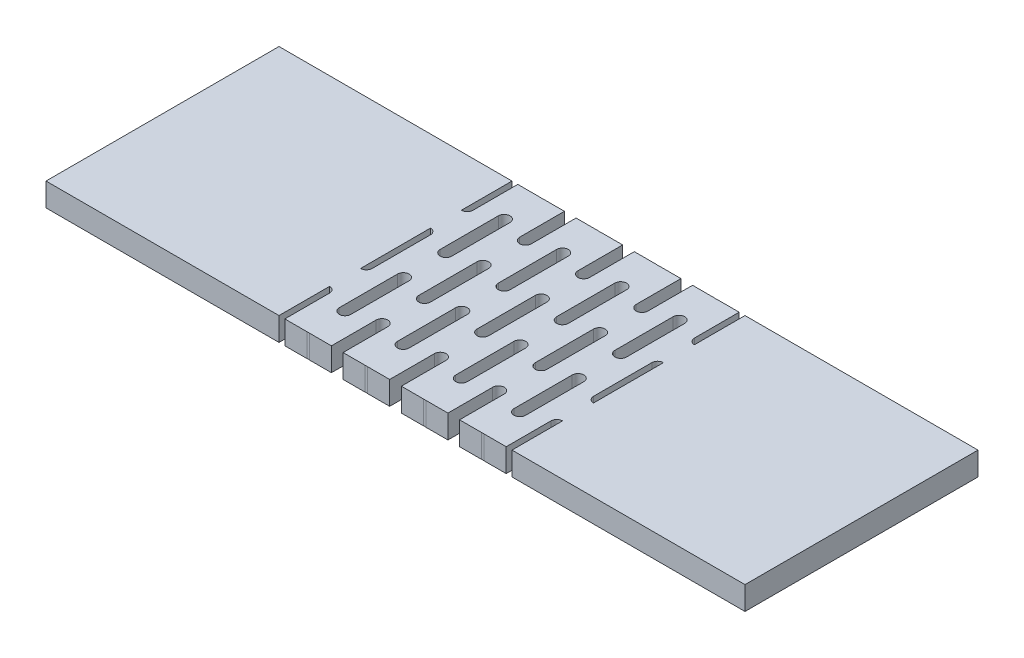
from build123d import *

# Parameters (mm, degrees)
SKETCH1_W           = 20
SKETCH1_H           = 20
BOSS_EXTRUDE1_DEPTH = 1
CUT_EXTRUDE1_DEPTH  = 1
FILL_START          = -1
FILL_PATTERN1_DEPTH = 2
SKETCH2_W           = 20
SKETCH2_H           = 20
BOSS_EXTRUDE2_DEPTH = 1


# Read off the part's stored shape, not the designer's step: Fill Pattern1
with BuildPart() as part:
    # Sketch1 → Boss-Extrude1 (new, symmetric)
    with BuildSketch(Plane(origin=(0, 0, 0), x_dir=(1, 0, 0), z_dir=(0, 1, 0))):
        Rectangle(SKETCH1_W, SKETCH1_H)
    extrude(amount=BOSS_EXTRUDE1_DEPTH, both=True)

    # Sketch1<4> → Cut-Extrude1 (cut, symmetric)
    with BuildSketch(Plane(origin=(0, 0, 0), x_dir=(1, 0, 0), z_dir=(0, 1, 0))):
        with BuildLine():
            Line((0.5, 2.5), (0.5, -2.5))
            ThreePointArc((0.5, -2.5), (0, -3), (-0.5, -2.5))
            Line((-0.5, -2.5), (-0.5, 2.5))
            ThreePointArc((-0.5, 2.5), (0, 3), (0.5, 2.5))
        make_face()
    extrude(amount=CUT_EXTRUDE1_DEPTH, both=True, mode=Mode.SUBTRACT)

    # Fill Pattern1 outline → Fill Pattern1 (cut)
    with BuildSketch(Plane(origin=(0, 0, 0), x_dir=(1, 0, 0), z_dir=(0, 1, 0)).offset(FILL_START)):
        with BuildLine():
            Line((0.5, -10), (0.5, -6.160254038))
            ThreePointArc((0.5, -6.160254038), (0, -5.660254038), (-0.5, -6.160254038))
            Line((-0.5, -6.160254038), (-0.5, -10))
            Line((-0.5, -10), (0.5, -10))
        make_face()
        with BuildLine():
            ThreePointArc((2.597603377, -10), (2.5, -9.990381057), (2.402396623, -10))
            Line((2.402396623, -10), (2.597603377, -10))
        make_face()
        with BuildLine():
            Line((-2.597603377, -10), (-2.402396623, -10))
            ThreePointArc((-2.402396623, -10), (-2.5, -9.990381057), (-2.597603377, -10))
        make_face()
        with BuildLine():
            Line((4.5, -6.160254038), (4.5, -10))
            Line((4.5, -10), (5.5, -10))
            Line((5.5, -10), (5.5, -6.160254038))
            ThreePointArc((5.5, -6.160254038), (5, -5.660254038), (4.5, -6.160254038))
        make_face()
        with BuildLine():
            Line((-5.5, -10), (-4.5, -10))
            Line((-4.5, -10), (-4.5, -6.160254038))
            ThreePointArc((-4.5, -6.160254038), (-5, -5.660254038), (-5.5, -6.160254038))
            Line((-5.5, -6.160254038), (-5.5, -10))
        make_face()
        with BuildLine():
            ThreePointArc((7.597603377, -10), (7.5, -9.990381057), (7.402396623, -10))
            Line((7.402396623, -10), (7.597603377, -10))
        make_face()
        with BuildLine():
            Line((-7.597603377, -10), (-7.402396623, -10))
            ThreePointArc((-7.402396623, -10), (-7.5, -9.990381057), (-7.597603377, -10))
        make_face()
        with BuildLine():
            Line((9.5, -6.160254038), (9.5, -10))
            Line((9.5, -10), (10, -10))
            Line((10, -10), (10, -5.660254038))
            ThreePointArc((10, -5.660254038), (9.646446609, -5.806700647), (9.5, -6.160254038))
        make_face()
        with BuildLine():
            Line((-10, -10), (-9.5, -10))
            Line((-9.5, -10), (-9.5, -6.160254038))
            ThreePointArc((-9.5, -6.160254038), (-9.646446609, -5.806700647), (-10, -5.660254038))
            Line((-10, -5.660254038), (-10, -10))
        make_face()
        with BuildLine():
            ThreePointArc((9.5, -2.5), (9.646446609, -2.853553391), (10, -3))
            Line((10, -3), (10, 3))
            ThreePointArc((10, 3), (9.646446609, 2.853553391), (9.5, 2.5))
            Line((9.5, 2.5), (9.5, -2.5))
        make_face()
        with BuildLine():
            Line((-10, 3), (-10, -3))
            ThreePointArc((-10, -3), (-9.646446609, -2.853553391), (-9.5, -2.5))
            Line((-9.5, -2.5), (-9.5, 2.5))
            ThreePointArc((-9.5, 2.5), (-9.646446609, 2.853553391), (-10, 3))
        make_face()
        with BuildLine():
            ThreePointArc((9.5, 6.160254038), (9.646446609, 5.806700647), (10, 5.660254038))
            Line((10, 5.660254038), (10, 10))
            Line((10, 10), (9.5, 10))
            Line((9.5, 10), (9.5, 6.160254038))
        make_face()
        with BuildLine():
            Line((-10, 10), (-10, 5.660254038))
            ThreePointArc((-10, 5.660254038), (-9.646446609, 5.806700647), (-9.5, 6.160254038))
            Line((-9.5, 6.160254038), (-9.5, 10))
            Line((-9.5, 10), (-10, 10))
        make_face()
        with BuildLine():
            ThreePointArc((7.402396623, 10), (7.5, 9.990381057), (7.597603377, 10))
            Line((7.597603377, 10), (7.402396623, 10))
        make_face()
        with BuildLine():
            Line((-7.402396623, 10), (-7.597603377, 10))
            ThreePointArc((-7.597603377, 10), (-7.5, 9.990381057), (-7.402396623, 10))
        make_face()
        with BuildLine():
            Line((5.5, 6.160254038), (5.5, 10))
            Line((5.5, 10), (4.5, 10))
            Line((4.5, 10), (4.5, 6.160254038))
            ThreePointArc((4.5, 6.160254038), (5, 5.660254038), (5.5, 6.160254038))
        make_face()
        with BuildLine():
            Line((-4.5, 10), (-5.5, 10))
            Line((-5.5, 10), (-5.5, 6.160254038))
            ThreePointArc((-5.5, 6.160254038), (-5, 5.660254038), (-4.5, 6.160254038))
            Line((-4.5, 6.160254038), (-4.5, 10))
        make_face()
        with BuildLine():
            ThreePointArc((2.402396623, 10), (2.5, 9.990381057), (2.597603377, 10))
            Line((2.597603377, 10), (2.402396623, 10))
        make_face()
        with BuildLine():
            Line((-2.402396623, 10), (-2.597603377, 10))
            ThreePointArc((-2.597603377, 10), (-2.5, 9.990381057), (-2.402396623, 10))
        make_face()
        with BuildLine():
            Line((0.5, 6.160254038), (0.5, 10))
            Line((0.5, 10), (-0.5, 10))
            Line((-0.5, 10), (-0.5, 6.160254038))
            ThreePointArc((-0.5, 6.160254038), (0, 5.660254038), (0.5, 6.160254038))
        make_face()
        with BuildLine():
            Line((8, -6.830127019), (8, -1.830127019))
            ThreePointArc((8, -1.830127019), (7.5, -1.330127019), (7, -1.830127019))
            Line((7, -1.830127019), (7, -6.830127019))
            ThreePointArc((7, -6.830127019), (7.5, -7.330127019), (8, -6.830127019))
        make_face()
        with BuildLine():
            Line((8, 1.830127019), (8, 6.830127019))
            ThreePointArc((8, 6.830127019), (7.5, 7.330127019), (7, 6.830127019))
            Line((7, 6.830127019), (7, 1.830127019))
            ThreePointArc((7, 1.830127019), (7.5, 1.330127019), (8, 1.830127019))
        make_face()
        with BuildLine():
            Line((5.5, -2.5), (5.5, 2.5))
            ThreePointArc((5.5, 2.5), (5, 3), (4.5, 2.5))
            Line((4.5, 2.5), (4.5, -2.5))
            ThreePointArc((4.5, -2.5), (5, -3), (5.5, -2.5))
        make_face()
        with BuildLine():
            Line((-7, 1.830127019), (-7, 6.830127019))
            ThreePointArc((-7, 6.830127019), (-7.5, 7.330127019), (-8, 6.830127019))
            Line((-8, 6.830127019), (-8, 1.830127019))
            ThreePointArc((-8, 1.830127019), (-7.5, 1.330127019), (-7, 1.830127019))
        make_face()
        with BuildLine():
            Line((-7, -6.830127019), (-7, -1.830127019))
            ThreePointArc((-7, -1.830127019), (-7.5, -1.330127019), (-8, -1.830127019))
            Line((-8, -1.830127019), (-8, -6.830127019))
            ThreePointArc((-8, -6.830127019), (-7.5, -7.330127019), (-7, -6.830127019))
        make_face()
        with BuildLine():
            Line((-4.5, -2.5), (-4.5, 2.5))
            ThreePointArc((-4.5, 2.5), (-5, 3), (-5.5, 2.5))
            Line((-5.5, 2.5), (-5.5, -2.5))
            ThreePointArc((-5.5, -2.5), (-5, -3), (-4.5, -2.5))
        make_face()
        with BuildLine():
            Line((3, 1.830127019), (3, 6.830127019))
            ThreePointArc((3, 6.830127019), (2.5, 7.330127019), (2, 6.830127019))
            Line((2, 6.830127019), (2, 1.830127019))
            ThreePointArc((2, 1.830127019), (2.5, 1.330127019), (3, 1.830127019))
        make_face()
        with BuildLine():
            Line((3, -6.830127019), (3, -1.830127019))
            ThreePointArc((3, -1.830127019), (2.5, -1.330127019), (2, -1.830127019))
            Line((2, -1.830127019), (2, -6.830127019))
            ThreePointArc((2, -6.830127019), (2.5, -7.330127019), (3, -6.830127019))
        make_face()
        with BuildLine():
            Line((-2, 1.830127019), (-2, 6.830127019))
            ThreePointArc((-2, 6.830127019), (-2.5, 7.330127019), (-3, 6.830127019))
            Line((-3, 6.830127019), (-3, 1.830127019))
            ThreePointArc((-3, 1.830127019), (-2.5, 1.330127019), (-2, 1.830127019))
        make_face()
        with BuildLine():
            Line((-2, -6.830127019), (-2, -1.830127019))
            ThreePointArc((-2, -1.830127019), (-2.5, -1.330127019), (-3, -1.830127019))
            Line((-3, -1.830127019), (-3, -6.830127019))
            ThreePointArc((-3, -6.830127019), (-2.5, -7.330127019), (-2, -6.830127019))
        make_face()
    extrude(amount=FILL_PATTERN1_DEPTH, mode=Mode.SUBTRACT)

    # Sketch2 → Boss-Extrude2 (add, symmetric)
    with BuildSketch(Plane(origin=(0, 0, 0), x_dir=(1, 0, 0), z_dir=(0, 1, 0))):
        with Locations((-20, 0)):
            Rectangle(SKETCH2_W, SKETCH2_H)
        with Locations((20, 0)):
            Rectangle(SKETCH2_W, SKETCH2_H)
    extrude(amount=BOSS_EXTRUDE2_DEPTH, both=True)


solid = part.part
